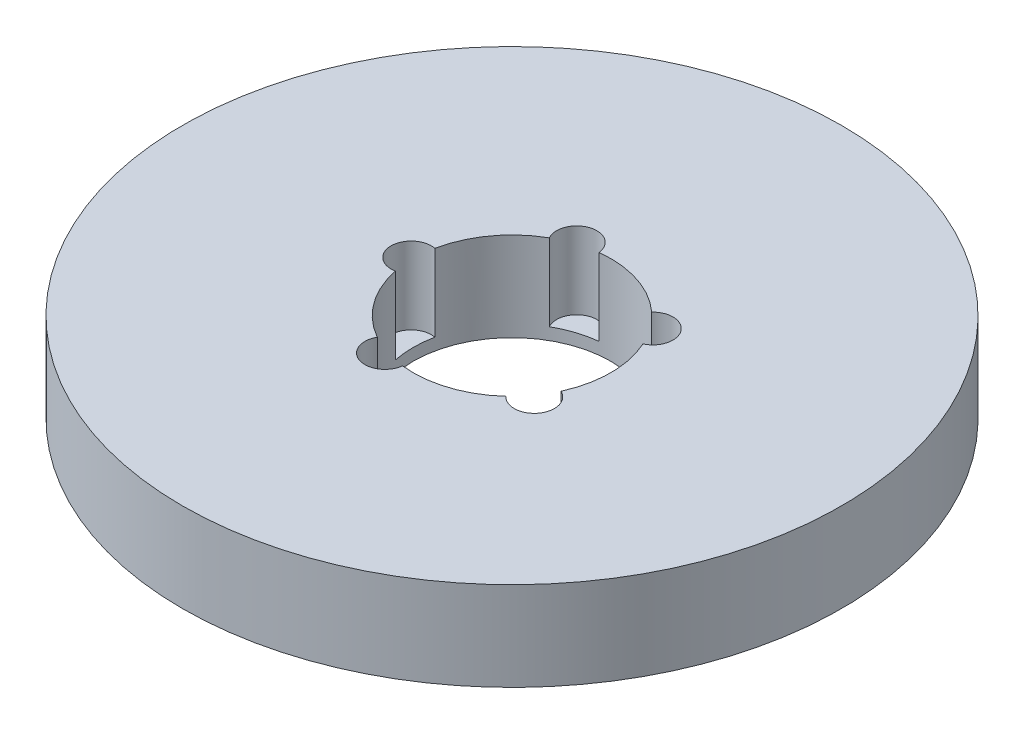
from build123d import *

# Parameters (mm, degrees)
SKETCH1_R           = 100
BOSS_EXTRUDE1_DEPTH = 27
SKETCH2_R           = 30
CUT_EXTRUDE1_DEPTH  = 144.975692393
SKETCH3_R           = 6.103815366
CUT_EXTRUDE2_DEPTH  = 23.355243157
CIRPATTERN1_COUNT   = 5


with BuildPart() as part:
    # Sketch1 → Boss-Extrude1 (new body)
    with BuildSketch(Plane(origin=(0, 0, 0), x_dir=(1, 0, 0), z_dir=(0, 1, 0))):
        Circle(SKETCH1_R)
    extrude(amount=BOSS_EXTRUDE1_DEPTH)

    # Sketch2 → Cut-Extrude1 (cut, through all)
    with BuildSketch(Plane(origin=(0, 0, 0), x_dir=(1, 0, 0), z_dir=(0, 1, 0))):
        Circle(SKETCH2_R)
    extrude(amount=CUT_EXTRUDE1_DEPTH, mode=Mode.SUBTRACT)

    # Sketch3 → Cut-Extrude2 (cut)
    with BuildSketch(Plane(origin=(0, 27, 0), x_dir=(1, 0, 0), z_dir=(0, 1, 0))):
        with Locations((-30.591261491, 0)):
            Circle(SKETCH3_R)
    cut_extrude2 = extrude(amount=-CUT_EXTRUDE2_DEPTH, mode=Mode.SUBTRACT)

    # CirPattern1: Cut-Extrude2 ×5 about axis
    cirpattern1_axis = Axis((0, 0, 0), (0, 1, 0))
    for i in range(1, CIRPATTERN1_COUNT):
        add(cut_extrude2.rotate(cirpattern1_axis, i * 360 / CIRPATTERN1_COUNT), mode=Mode.SUBTRACT)


solid = part.part
